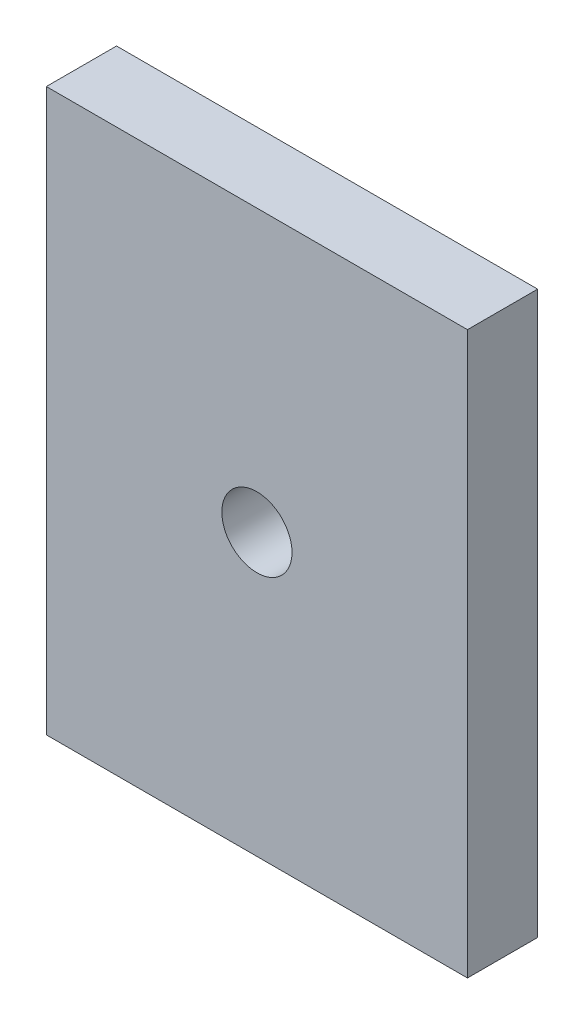
from build123d import *

# Parameters (mm, degrees)
SKETCH1_W           = 76.2
SKETCH1_H           = 101.6
BOSS_EXTRUDE1_DEPTH = 12.7
SKETCH2_R           = 6.35
CUT_EXTRUDE1_DEPTH  = 65.757547823


with BuildPart() as part:
    # Sketch1 → Boss-Extrude1 (new body)
    with BuildSketch(Plane.XY):
        Rectangle(SKETCH1_W, SKETCH1_H)
    extrude(amount=BOSS_EXTRUDE1_DEPTH)

    # Sketch2 → Cut-Extrude1 (cut, through all)
    with BuildSketch(Plane.XY.offset(12.7)):
        Circle(SKETCH2_R)
    extrude(amount=-CUT_EXTRUDE1_DEPTH, mode=Mode.SUBTRACT)


solid = part.part
